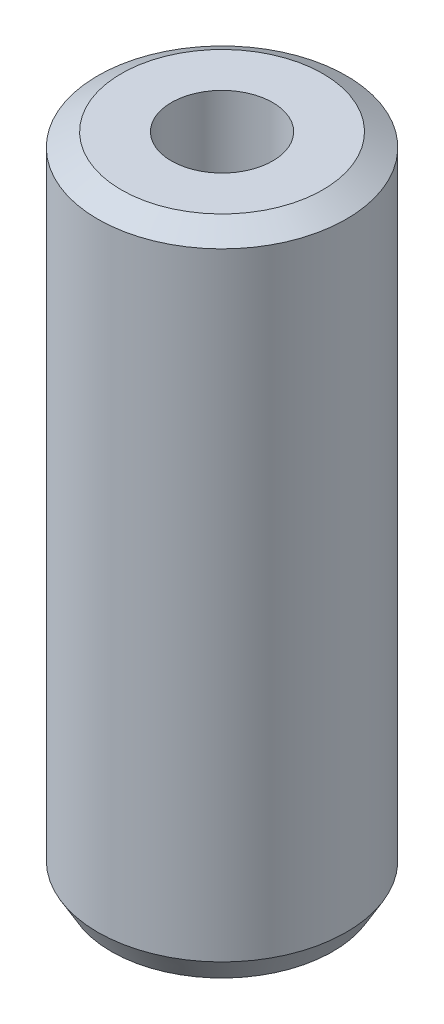
from build123d import *
from OCP.BRepFilletAPI import BRepFilletAPI_MakeChamfer

# Parameters (mm, degrees)
SKETCH1_R           = 35
BOSS_EXTRUDE1_DEPTH = 184.357450578
SKETCH2_R           = 14.267730039
CUT_EXTRUDE1_DEPTH  = 191.886535889
CHAMFER1_SIZE       = 3.826873483
CHAMFER1_SIZE2      = 6.628339306


with BuildPart() as part:
    # Sketch1 → Boss-Extrude1 (new body)
    with BuildSketch(Plane(origin=(0, 0, 0), x_dir=(1, 0, 0), z_dir=(0, 1, 0))):
        Circle(SKETCH1_R)
    extrude(amount=BOSS_EXTRUDE1_DEPTH)

    # Sketch2 → Cut-Extrude1 (cut, through all)
    with BuildSketch(Plane(origin=(0, 0, 0), x_dir=(1, 0, 0), z_dir=(0, 1, 0))):
        Circle(SKETCH2_R)
    extrude(amount=CUT_EXTRUDE1_DEPTH, mode=Mode.SUBTRACT)

    # Chamfer1: one chamfer whose edges measure the first distance from different faces: ONE call of the kernel's chamfer builder (chamfer() names one face for all edges)
    chamfer1_edges_1 = [part.edges().sort_by_distance(p)[0] for p in [
        (-35, 184.357450578, 0),
    ]]
    chamfer1_side_1 = [part.faces().sort_by_distance(p)[0] for p in [
        (-35, 92.178725289, 0),
    ]]
    chamfer1_edges_2 = [part.edges().sort_by_distance(p)[0] for p in [
        (-35, 0, 0),
    ]]
    chamfer1_side_2 = [part.faces().sort_by_distance(p)[0] for p in [
        (-34.010050506, 0, 0),
    ]]
    chamfer1 = BRepFilletAPI_MakeChamfer(part.part.solid().wrapped)
    for e in chamfer1_edges_1:
        chamfer1.Add(CHAMFER1_SIZE, CHAMFER1_SIZE2, e.wrapped, chamfer1_side_1[0].wrapped)  # the first distance lies on this face
    for e in chamfer1_edges_2:
        chamfer1.Add(CHAMFER1_SIZE, CHAMFER1_SIZE2, e.wrapped, chamfer1_side_2[0].wrapped)  # the first distance lies on this face
    add(Compound.cast(chamfer1.Shape()), mode=Mode.REPLACE)


solid = part.part
